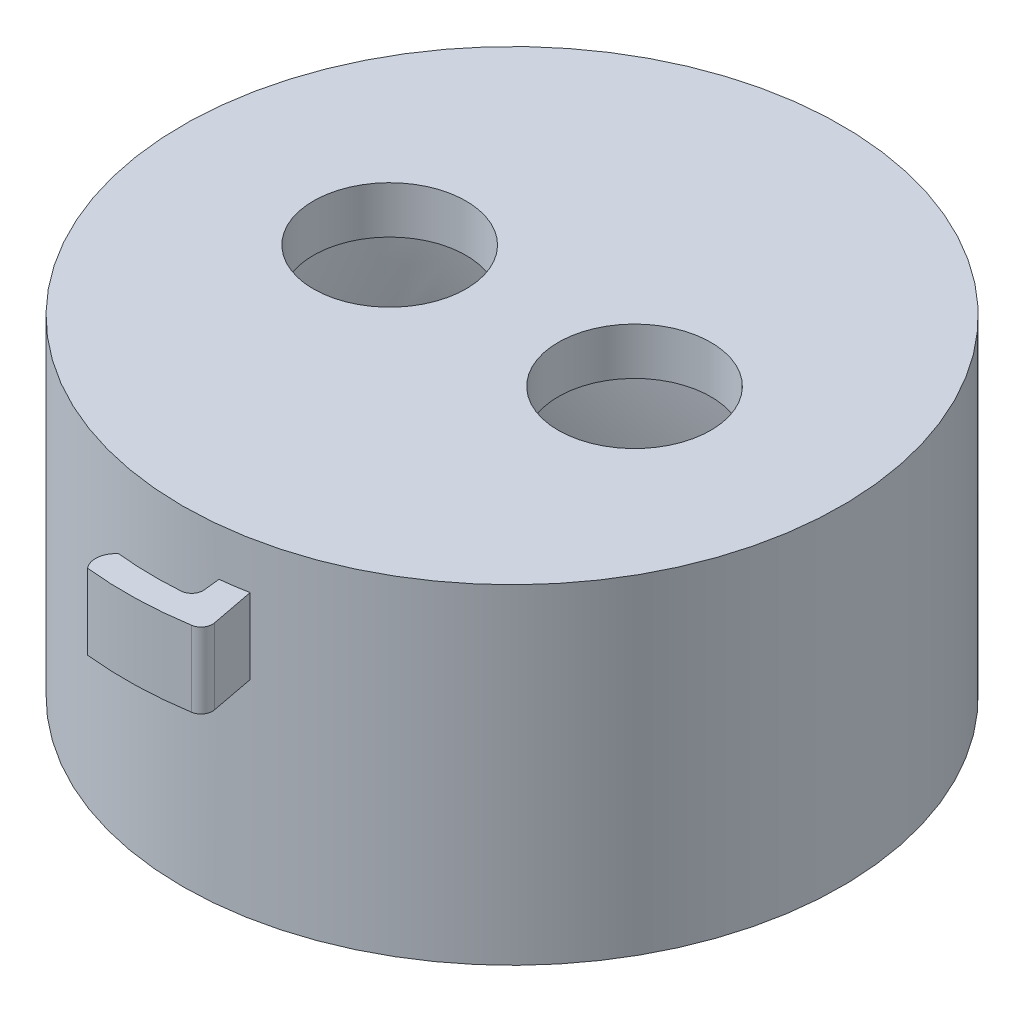
from build123d import *

# Parameters (mm, degrees)
ESBO_O1_R                = 35
RESSALTO_EXTRUS_O1_DEPTH = 17.5
ESBO_O2_R                = 8.1
CORTE_EXTRUS_O1_DEPTH    = 61.621778265
RESSALTO_EXTRUS_O2_DEPTH = 8


with BuildPart() as part:
    # Esboço1 → Ressalto-extrusão1 (new, symmetric)
    with BuildSketch(Plane(origin=(0, 0, 0), x_dir=(1, 0, 0), z_dir=(0, 1, 0))):
        with Locations(Location((0, 0, 0), (0, 0, 270))):
            Circle(ESBO_O1_R)
    extrude(amount=RESSALTO_EXTRUS_O1_DEPTH, both=True)

    # Esboço2 → Corte-extrusão1 (cut, through all)
    with BuildSketch(Plane(origin=(0, 17.5, 0), x_dir=(1, 0, 0), z_dir=(0, 1, 0))):
        with Locations(Location((-13, 0, 0), (0, 0, 270))):
            Circle(ESBO_O2_R)
        with Locations(Location((13, 0, 0), (0, 0, 270))):
            Circle(ESBO_O2_R)
    extrude(amount=-CORTE_EXTRUS_O1_DEPTH, mode=Mode.SUBTRACT)

    # Loft de corte1: read off the stored shape, not the designer's step
    # Loft de corte1: loft between two sections, ruled curve by curve
    loft_de_corte1_from = [
        Edge.make_bspline([(-27.910850381, -17.5, 11.663915766), (-4.583018848, -17.5, 67.485616529), (51.238681914, -17.5, 44.157784996), (27.910850381, -17.5, -11.663915766), (4.583018848, -17.5, -67.485616529), (-51.238681914, -17.5, -44.157784996), (-27.910850381, -17.5, 11.663915766)], [0, 0, 0, 0, 0.5, 0.5, 0.5, 1, 1, 1, 1], 3, [1, 0.333333333, 0.333333333, 1, 0.333333333, 0.333333333, 1]),
    ]
    loft_de_corte1_to = [
        Edge.make_bspline([(-29.148312313, 12.5, -4.54157344), (-38.231459193, 12.5, 53.755051185), (20.065165432, 12.5, 62.838198066), (29.148312313, 12.5, 4.54157344), (38.231459193, 12.5, -53.755051185), (-20.065165432, 12.5, -62.838198066), (-29.148312313, 12.5, -4.54157344)], [0, 0, 0, 0, 0.5, 0.5, 0.5, 1, 1, 1, 1], 3, [1, 0.333333333, 0.333333333, 1, 0.333333333, 0.333333333, 1]),
    ]
    loft_de_corte1 = Solid(Shell([*[Face.make_surface_from_curves(loft_de_corte1_from[k], loft_de_corte1_to[k]) for k in range(1)], Face(Wire(loft_de_corte1_from)), Face(Wire(loft_de_corte1_to))]))
    add(loft_de_corte1, mode=Mode.SUBTRACT)

    # Esboço6 → Ressalto-extrusão2 (add)
    with BuildSketch(Plane(origin=(0, 12.5, 0), x_dir=(1, 0, 0), z_dir=(0, 1, 0))):
        with BuildLine():
            ThreePointArc((6.466441324, -40.486851404), (7.259420992, -39.991219283), (7.455915524, -39.076966664))
            Line((7.455915524, -39.076966664), (6.559691913, -34.379797004))
            ThreePointArc((6.559691913, -34.379797004), (5.126373139, -34.622540323), (3.684210526, -34.805554051))
            Line((3.684210526, -34.805554051), (3.871624166, -36.576092278))
            ThreePointArc((3.871624166, -36.576092278), (3.598996432, -37.472019199), (2.765626457, -37.899225722))
            ThreePointArc((2.765626457, -37.899225722), (-0.619647606, -37.994947517), (-4, -37.788887255))
            ThreePointArc((-4, -37.788887255), (-4.775763274, -39.215151716), (-4.315789474, -40.77222046))
            ThreePointArc((-4.315789474, -40.77222046), (1.084750995, -40.985647674), (6.466441324, -40.486851404))
        make_face()
    extrude(amount=-RESSALTO_EXTRUS_O2_DEPTH)


solid = part.part
